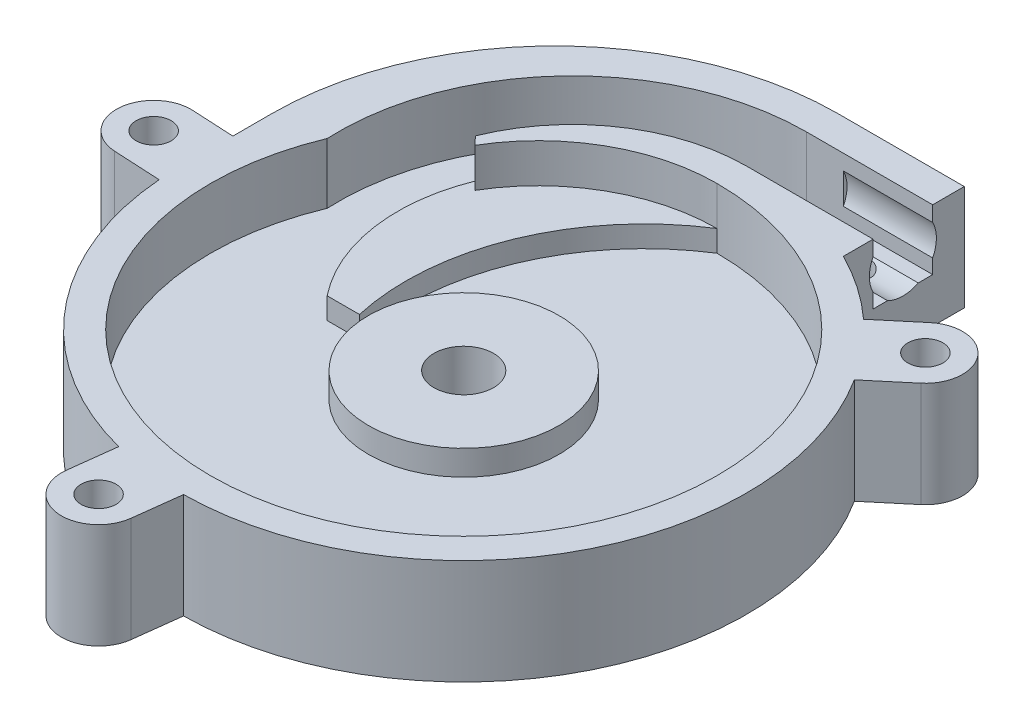
from build123d import *
from build123d.topology import SkipClean

# Parameters (mm, degrees)
SKETCH1_R          = 30.1625
SKETCH1_R_2        = 3.175
EXTRUDE1_DEPTH     = 4.7625
EXTRUDE2_START     = 2.286
SKETCH2_R          = 30.1625
SKETCH2_R_2        = 26.9875
EXTRUDE2_DEPTH     = 2.286
EXTRUDE3_DEPTH     = 2.286
CUT_EXTRUDE1_START = -2.286
CUT_EXTRUDE1_DEPTH = 2.286
EXTRUDE4_DEPTH     = 4.16052
EXTRUDE6_START     = -4.7625
EXTRUDE6_DEPTH     = 4.7625
EXTRUDE7_START     = 6.44652
EXTRUDE7_DEPTH     = 6.44652
EXTRUDE8_START     = -4.7625
EXTRUDE8_OUTLINE_R = 1.8669
EXTRUDE8_DEPTH     = 11.20902
EXTRUDE8_START_2   = 3.945384182
EXTRUDE8_2_DEPTH   = 9.525
EXTRUDE9_START     = 2.667
SKETCH11_R         = 10.16
SKETCH11_R_2       = 3.175
EXTRUDE9_DEPTH     = 2.667
CHAMFER1_SIZE      = 1.5875
SPLIT1_OUTLINE_W   = 1.35255
SPLIT1_OUTLINE_H   = 4.631769236


# Read off the part's stored shape, not the designer's step: Extrude8, Split1
with BuildPart() as part:
    # Sketch1 → Extrude1 (new body)
    with BuildSketch(Plane(origin=(0, 0, 0), x_dir=(1, 0, 0), z_dir=(0, 1, 0))):
        with Locations(Location((0, 0, 0), (0, 0, 270))):
            Circle(SKETCH1_R)
        with Locations(Location((0, 0, 0), (0, 0, 270))):
            Circle(SKETCH1_R_2, mode=Mode.SUBTRACT)
    extrude(amount=-EXTRUDE1_DEPTH)

    # Sketch2 → Extrude2 (add)
    with BuildSketch(Plane(origin=(0, 0, 0), x_dir=(-1, 0, 0), z_dir=(0, 1, 0)).offset(EXTRUDE2_START)):
        with Locations(Location((0, 0, 0), (0, 0, 90))):
            Circle(SKETCH2_R)
        with Locations(Location((0, 0, 0), (0, 0, 90))):
            Circle(SKETCH2_R_2, mode=Mode.SUBTRACT)
    extrude(amount=-EXTRUDE2_DEPTH)

    # Sketch3 → Extrude3 (add)
    with BuildSketch(Plane(origin=(0, 0, 0), x_dir=(-1, 0, 0), z_dir=(0, 1, 0))):
        with BuildLine():
            Line((0, -26.9875), (0, -30.1625))
            ThreePointArc((0, -30.1625), (16.746389739, -19.65084319), (14.559871939, 0))
            Line((14.559871939, 0), (11.1125, 0))
            ThreePointArc((11.1125, 0), (9.819400834, -15.249165049), (0, -26.9875))
        make_face()
    extrude(amount=EXTRUDE3_DEPTH)

    # Sketch4 → Cut-Extrude1 (cut)
    with BuildSketch(Plane(origin=(0, 2.286, 0), x_dir=(-1, 0, 0), z_dir=(0, 1, 0)).offset(CUT_EXTRUDE1_START)):
        with BuildLine():
            ThreePointArc((0, -30.1625), (13.425358958, -27.009926751), (24.044290895, -18.211218564))
            ThreePointArc((24.044290895, -18.211218564), (24.79254584, -14.324226887), (24.91653318, -10.367812235))
            ThreePointArc((24.91653318, -10.367812235), (20.915943614, -17.054279785), (15.171790072, -22.31909367))
            ThreePointArc((15.171790072, -22.31909367), (8.539646316, -28.085673104), (0, -30.1625))
        make_face()
    extrude(amount=CUT_EXTRUDE1_DEPTH, mode=Mode.SUBTRACT)

    # Sketch5 → Extrude4 (add)
    with SkipClean():  # the faces are left unmerged after this step: merging them gives an invalid solid
        with BuildSketch(Plane(origin=(0, 2.286, 0), x_dir=(-1, 0, 0), z_dir=(0, 1, 0))):
            with BuildLine():
                ThreePointArc((0, -30.1625), (10.41213166, -26.974120661), (17.253717724, -18.502347019))
                Line((17.253717724, -18.502347019), (16.415554359, -17.603526852))
                ThreePointArc((16.415554359, -17.603526852), (9.454223619, -24.475944781), (0, -26.9875))
                ThreePointArc((0, -26.9875), (-14.975376849, 22.451352843), (24.91653318, -10.367812235))
                ThreePointArc((24.91653318, -10.367812235), (24.79254584, -14.324226887), (24.044290895, -18.211218564))
                ThreePointArc((24.044290895, -18.211218564), (-13.425358958, 27.009926751), (0, -30.1625))
            make_face()
        extrude(amount=EXTRUDE4_DEPTH)

    # Sketch7 → Extrude6 (add)
    with BuildSketch(Plane.XZ.offset(4.7625).offset(EXTRUDE6_START)):
        with BuildLine():
            Line((13.470384182, -39.878), (0, -39.878))
            ThreePointArc((0, -39.878), (-21.328108288, -31.043608288), (-30.1625, -9.7155))
            Line((-30.1625, -9.7155), (-30.1625, 0))
            ThreePointArc((-30.1625, 0), (-21.328108288, -21.328108288), (0, -30.1625))
            ThreePointArc((0, -30.1625), (6.919752073, -29.358021689), (13.470384182, -26.9875))
            Line((13.470384182, -26.9875), (13.470384182, -39.878))
        make_face()
    extrude(amount=EXTRUDE6_DEPTH)

    # Sketch8 → Extrude7 (add)
    with BuildSketch(Plane(origin=(0, 0, 0), x_dir=(-1, 0, 0), z_dir=(0, 1, 0)).offset(EXTRUDE7_START)):
        with BuildLine():
            Line((-13.470384182, -39.878), (-13.470384182, -36.5125))
            Line((-13.470384182, -36.5125), (0, -36.5125))
            ThreePointArc((0, -36.5125), (15.108481284, -31.416698661), (24.044290895, -18.211218564))
            ThreePointArc((24.044290895, -18.211218564), (28.592064724, -9.605740006), (30.1625, 0))
            Line((30.1625, 0), (30.1625, -9.7155))
            ThreePointArc((30.1625, -9.7155), (21.328108288, -31.043608288), (0, -39.878))
            Line((0, -39.878), (-13.470384182, -39.878))
        make_face()
        with BuildLine():
            Line((-13.470384182, -30.1625), (0, -30.1625))
            ThreePointArc((0, -30.1625), (-6.919752073, -29.358021689), (-13.470384182, -26.9875))
            Line((-13.470384182, -26.9875), (-13.470384182, -30.1625))
        make_face()
    extrude(amount=-EXTRUDE7_DEPTH)

    # Extrude8 outline → Extrude8 (add)
    # profile 1 of 3: a face of its own
    with BuildSketch(Plane(origin=(0, 0, 0), x_dir=(1, 0, 0), z_dir=(0, 1, 0)).offset(EXTRUDE8_START)):
        with BuildLine():
            Line((-30.1625, 0), (-30.1625, 5.554946141))
            Line((-30.1625, 5.554946141), (-34.669428175, 5.791144238))
            ThreePointArc((-34.669428175, 5.791144238), (-38.840447467, 2.035541598), (-35.084844828, -2.135477694))
            Line((-35.084844828, -2.135477694), (-30.066989082, -2.398452371))
            ThreePointArc((-30.066989082, -2.398452371), (-30.138612812, -1.200176665), (-30.1625, 0))
        make_face()
        with Locations((-34.877136501, 1.827833272)):
            Circle(EXTRUDE8_OUTLINE_R, mode=Mode.SUBTRACT)
    # profile 2 of 3: a face of its own
    with BuildSketch(Plane(origin=(0, 0, 0), x_dir=(1, 0, 0), z_dir=(0, 1, 0)).offset(EXTRUDE8_START)):
        with BuildLine():
            ThreePointArc((20.353863178, 22.259754266), (23.105815515, 19.388081277), (25.45598983, 16.179276498))
            Line((25.45598983, 16.179276498), (29.305165502, 19.409118385))
            ThreePointArc((29.305165502, 19.409118385), (29.79434106, 25.000420595), (24.20303885, 25.489596152))
            Line((24.20303885, 25.489596152), (20.353863178, 22.259754266))
        make_face()
        with Locations((26.754102176, 22.449357268)):
            Circle(EXTRUDE8_OUTLINE_R, mode=Mode.SUBTRACT)
    # profile 3 of 3: a face of its own
    with BuildSketch(Plane(origin=(0, 0, 0), x_dir=(1, 0, 0), z_dir=(0, 1, 0)).offset(EXTRUDE8_START)):
        with BuildLine():
            ThreePointArc((0.295242727, -30.161054988), (-3.67588407, -29.937673299), (-7.583092352, -29.193717074))
            Line((-7.583092352, -29.193717074), (-8.195454358, -34.181005389))
            ThreePointArc((-8.195454358, -34.181005389), (-4.739955775, -38.603841885), (-0.317119279, -35.148343303))
            Line((-0.317119279, -35.148343303), (0.295242727, -30.161054988))
        make_face()
        with Locations((-4.256286818, -34.664674346)):
            Circle(EXTRUDE8_OUTLINE_R, mode=Mode.SUBTRACT)
    extrude(amount=EXTRUDE8_DEPTH)

    # Extrude8 2 outline → Extrude8 2 (cut)
    with BuildSketch(Plane.YZ.offset(EXTRUDE8_START_2)):
        with BuildLine():
            Line((1.538642455, -30.1625), (4.811357545, -30.1625))
            ThreePointArc((4.811357545, -30.1625), (3.175, -29.765625), (1.538642455, -30.1625))
        make_face()
        with BuildLine():
            Line((0, -34.973857545), (0, -31.701142455))
            ThreePointArc((0, -31.701142455), (-0.396875, -33.3375), (0, -34.973857545))
        make_face()
        with BuildLine():
            ThreePointArc((1.538642455, -36.5125), (3.175, -36.909375), (4.811357545, -36.5125))
            Line((4.811357545, -36.5125), (1.538642455, -36.5125))
        make_face()
    extrude(amount=EXTRUDE8_2_DEPTH, mode=Mode.SUBTRACT)

    # Sketch11 → Extrude9 (add)
    with BuildSketch(Plane(origin=(0, 0, 0), x_dir=(-1, 0, 0), z_dir=(0, 1, 0)).offset(EXTRUDE9_START)):
        with Locations(Location((0, 0, 0), (0, 0, 90))):
            Circle(SKETCH11_R)
        with Locations(Location((0, 0, 0), (0, 0, 90))):
            Circle(SKETCH11_R_2, mode=Mode.SUBTRACT)
    extrude(amount=-EXTRUDE9_DEPTH)

    # Chamfer1
    chamfer1_edges = [part.edges().sort_by_distance(p)[0] for p in [
        (-36.744036501, -4.7625, -1.827833272),
        (-6.123186818, -4.7625, 34.664674346),
        (24.887202176, -4.7625, -22.449357268),
    ]]
    chamfer(chamfer1_edges, length=CHAMFER1_SIZE)

    # Split1 outline → Split1 (revolve, cut)
    with SkipClean():  # the faces are left unmerged after this step: merging them gives an invalid solid
        with BuildSketch(Plane(origin=(8.707884182, 0, -33.3375), x_dir=(1, 0, 0), z_dir=(0, 0, 1))):
            with Locations((0.676275, -2.446615382)):
                Rectangle(SPLIT1_OUTLINE_W, SPLIT1_OUTLINE_H)
        revolve(axis=Axis((8.707884182, 0, -33.3375), (0, 1, 0)), mode=Mode.SUBTRACT)


solid = part.part
